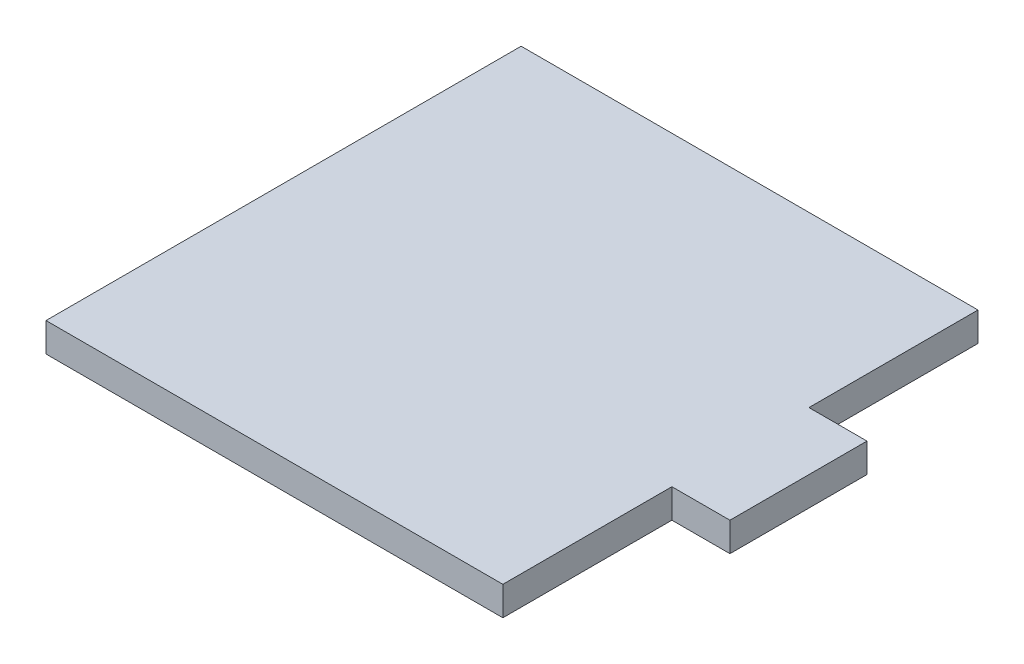
from build123d import *

# Parameters (mm, degrees)
BOSS_EXTRUDE1_DEPTH = 3.175


with BuildPart() as part:
    # Sketch1 → Boss-Extrude1 (new body)
    with BuildSketch(Plane(origin=(0, 0, 0), x_dir=(1, 0, 0), z_dir=(0, 1, 0))):
        Polygon((25, 18.5), (-25, 18.5), (-25, 0), (-25, -15), (-25, -33.5), (25, -33.5), (25, -15), (31.35, -15), (31.35, 0), (25, 0), align=None)
    extrude(amount=BOSS_EXTRUDE1_DEPTH)


solid = part.part
